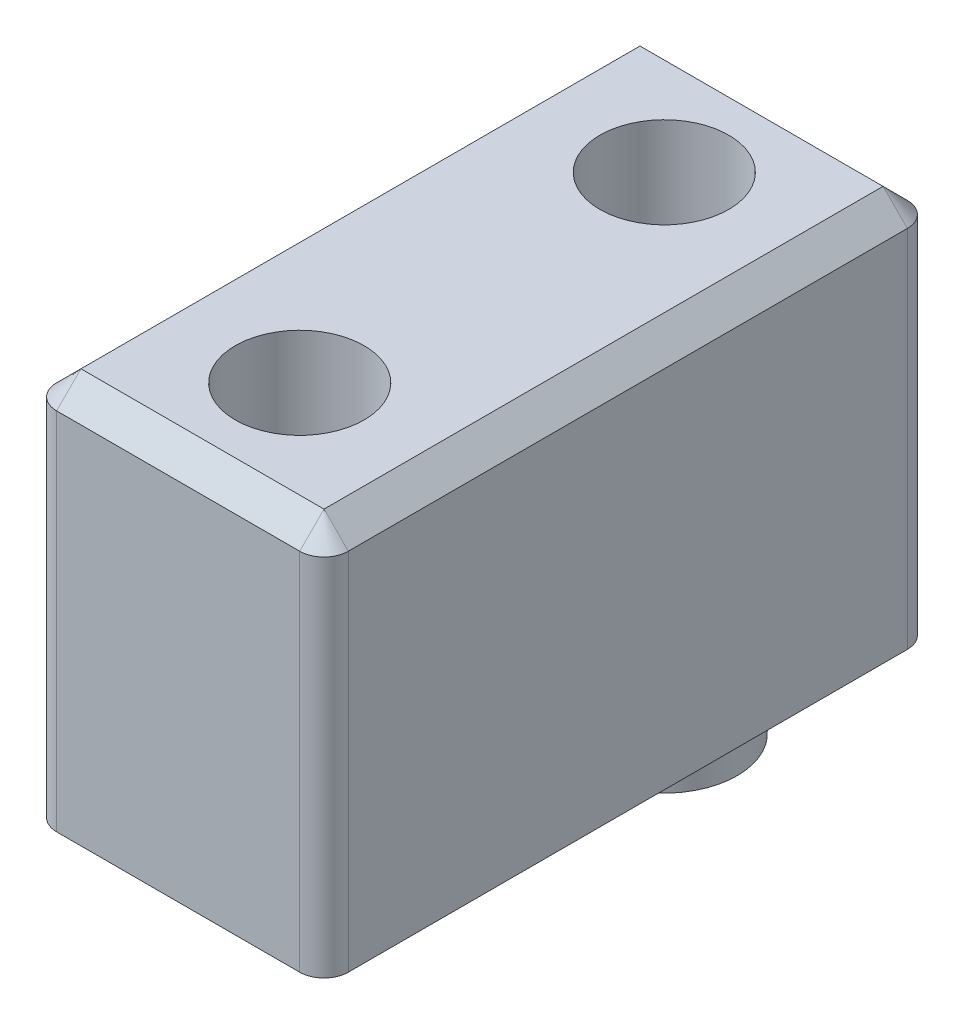
from build123d import *

# Parameters (mm, degrees)
SKETCH1_W           = 12
SKETCH1_H           = 25
SKETCH1_R           = 2.65
BOSS_EXTRUDE1_DEPTH = 8
SKETCH2_R           = 3
SKETCH2_R_2         = 2.5
BOSS_EXTRUDE2_DEPTH = 4
FILLET1_R           = 1
CHAMFER1_SIZE       = 1


with BuildPart() as part:
    # Sketch1 → Boss-Extrude1 (new, symmetric)
    with BuildSketch(Plane(origin=(0, 0, 0), x_dir=(1, 0, 0), z_dir=(0, 1, 0))):
        Rectangle(SKETCH1_W, SKETCH1_H)
        with Locations((0, 7.5)):
            Circle(SKETCH1_R, mode=Mode.SUBTRACT)
        with Locations((0, -7.5)):
            Circle(SKETCH1_R, mode=Mode.SUBTRACT)
    extrude(amount=BOSS_EXTRUDE1_DEPTH, both=True)

    # Sketch2 → Boss-Extrude2 (add)
    with BuildSketch(Plane.XZ.offset(8)):
        with Locations((0, -7.5)):
            Circle(SKETCH2_R)
        with Locations((0, -7.5)):
            Circle(SKETCH2_R_2, mode=Mode.SUBTRACT)
    extrude(amount=BOSS_EXTRUDE2_DEPTH)

    # Fillet1
    fillet1_edges = [part.edges().sort_by_distance(p)[0] for p in [
        (-6, 0, 12.5),
        (-6, 0, -12.5),
        (6, 0, -12.5),
        (6, 0, 12.5),
    ]]
    fillet(fillet1_edges, radius=FILLET1_R)

    # Chamfer1
    chamfer1_edges = [part.edges().sort_by_distance(p)[0] for p in [
        (0, 8, -12.5),
        (-5.707106781, 8, -12.207106781),
        (5.707106781, 8, -12.207106781),
        (-6, 8, 0),
        (6, 8, 0),
        (-5.707106781, 8, 12.207106781),
        (5.707106781, 8, 12.207106781),
        (0, 8, 12.5),
    ]]
    chamfer(chamfer1_edges, length=CHAMFER1_SIZE)


solid = part.part
